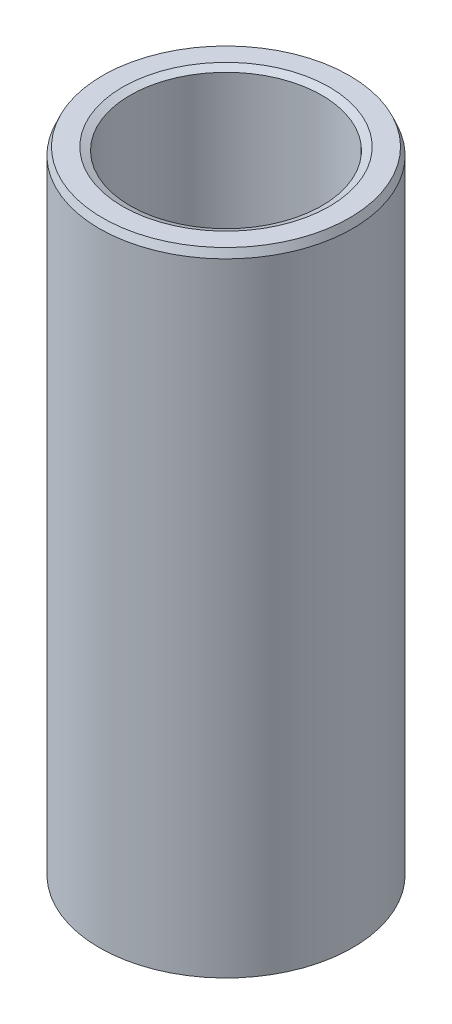
from build123d import *
from OCP.BRepFilletAPI import BRepFilletAPI_MakeChamfer

# Parameters (mm, degrees)
SKETCH1_R           = 55
BOSS_EXTRUDE1_DEPTH = 275.141454602
SKETCH2_R           = 41.61275278
CUT_EXTRUDE1_DEPTH  = 286.924500595
CHAMFER1_SIZE       = 3.291951314
CHAMFER1_SIZE2      = 1.407131311


with BuildPart() as part:
    # Sketch1 → Boss-Extrude1 (new body)
    with BuildSketch(Plane(origin=(0, 0, 0), x_dir=(1, 0, 0), z_dir=(0, 1, 0))):
        Circle(SKETCH1_R)
    extrude(amount=BOSS_EXTRUDE1_DEPTH)

    # Sketch2 → Cut-Extrude1 (cut, through all)
    with BuildSketch(Plane(origin=(0, 0, 0), x_dir=(1, 0, 0), z_dir=(0, 1, 0))):
        Circle(SKETCH2_R)
    extrude(amount=CUT_EXTRUDE1_DEPTH, mode=Mode.SUBTRACT)

    # Chamfer1: one chamfer whose edges measure the first distance from different faces: ONE call of the kernel's chamfer builder (chamfer() names one face for all edges)
    chamfer1_edges_1 = [part.edges().sort_by_distance(p)[0] for p in [
        (-41.61275278, 275.141454602, 0),
    ]]
    chamfer1_side_1 = [part.faces().sort_by_distance(p)[0] for p in [
        (-53.444365081, 275.141454602, 0),
    ]]
    chamfer1_edges_2 = [part.edges().sort_by_distance(p)[0] for p in [
        (-41.61275278, 0, 0),
    ]]
    chamfer1_side_2 = [part.faces().sort_by_distance(p)[0] for p in [
        (-41.61275278, 137.570727301, 0),
    ]]
    chamfer1_edges_3 = [part.edges().sort_by_distance(p)[0] for p in [
        (-55, 0, 0),
    ]]
    chamfer1_side_3 = [part.faces().sort_by_distance(p)[0] for p in [
        (-53.444365081, 0, 0),
    ]]
    chamfer1_edges_4 = [part.edges().sort_by_distance(p)[0] for p in [
        (-55, 275.141454602, 0),
    ]]
    chamfer1_side_4 = [part.faces().sort_by_distance(p)[0] for p in [
        (-55, 137.570727301, 0),
    ]]
    chamfer1 = BRepFilletAPI_MakeChamfer(part.part.solid().wrapped)
    for e in chamfer1_edges_1:
        chamfer1.Add(CHAMFER1_SIZE, CHAMFER1_SIZE2, e.wrapped, chamfer1_side_1[0].wrapped)  # the first distance lies on this face
    for e in chamfer1_edges_2:
        chamfer1.Add(CHAMFER1_SIZE, CHAMFER1_SIZE2, e.wrapped, chamfer1_side_2[0].wrapped)  # the first distance lies on this face
    for e in chamfer1_edges_3:
        chamfer1.Add(CHAMFER1_SIZE, CHAMFER1_SIZE2, e.wrapped, chamfer1_side_3[0].wrapped)  # the first distance lies on this face
    for e in chamfer1_edges_4:
        chamfer1.Add(CHAMFER1_SIZE, CHAMFER1_SIZE2, e.wrapped, chamfer1_side_4[0].wrapped)  # the first distance lies on this face
    add(Compound.cast(chamfer1.Shape()), mode=Mode.REPLACE)


solid = part.part
